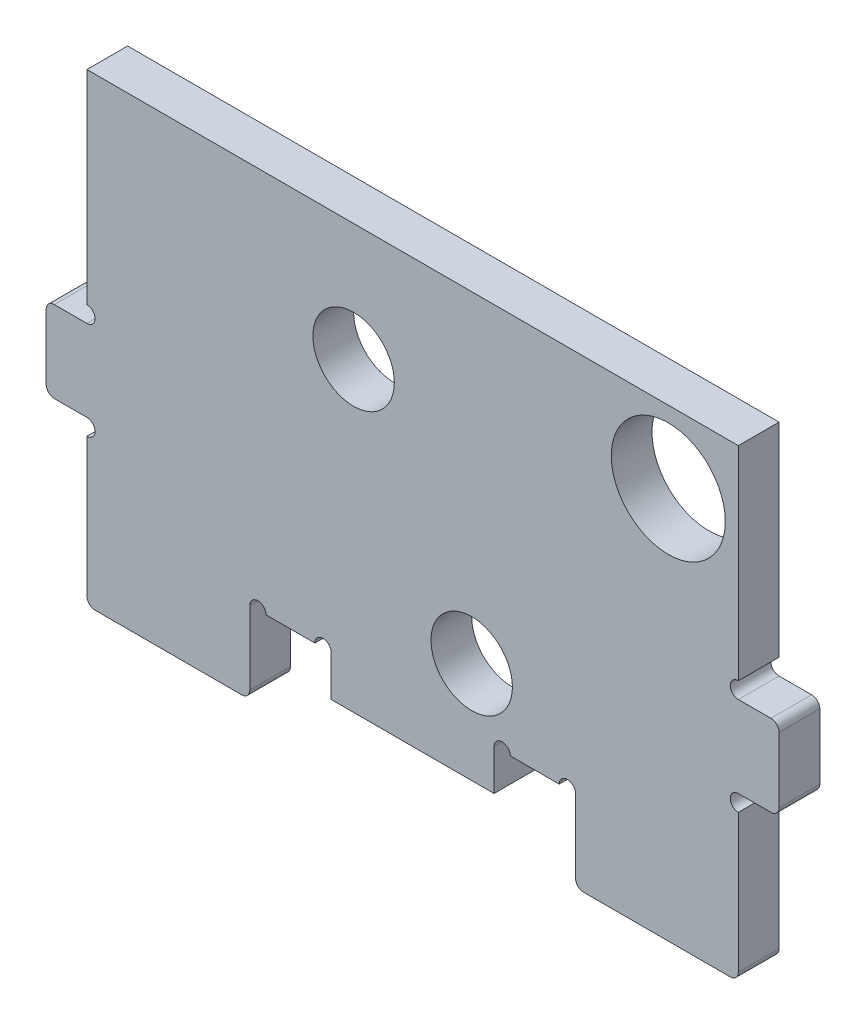
from build123d import *

# Parameters (mm, degrees)
SKETCH_1_W          = 80
SKETCH_1_H          = 52
EXTRUDE_1_DEPTH     = 5
SKETCH_2_R          = 7
CUT_EXTRUDE_1_DEPTH = 5
SKETCH_7_R          = 5
CUT_EXTRUDE_4_DEPTH = 10
SKETCH_10_W         = 10
SKETCH_10_H         = 5
CUT_EXTRUDE_5_DEPTH = 10
SKETCH_14_W         = 20
SKETCH_14_H         = 5
EXTRUDE_4_DEPTH     = 5
SKETCH_15_W         = 5
SKETCH_15_H         = 10
EXTRUDE_5_DEPTH     = 5
SKETCH_11_R         = 1
CUT_EXTRUDE_6_DEPTH = 10
FILLET_2_R          = 1


with BuildPart() as part:
    # 스케치1 → 보스-돌출1 (new body)
    with BuildSketch(Plane.XY):
        with Locations((40, 26)):
            Rectangle(SKETCH_1_W, SKETCH_1_H)
    extrude(amount=EXTRUDE_1_DEPTH)

    # 스케치2 → 컷-돌출1 (cut)
    with BuildSketch(Plane.XY.offset(5)):
        with Locations((71.393420887, 43.125)):
            Circle(SKETCH_2_R)
    extrude(amount=-CUT_EXTRUDE_1_DEPTH, mode=Mode.SUBTRACT)

    # 스케치7 → 컷-돌출4 (cut)
    with BuildSketch(Plane.XY.offset(5)):
        with Locations((32.75, 37.557368355)):
            Circle(SKETCH_7_R)
        with Locations((47.25, 12.442631645)):
            Circle(SKETCH_7_R)
    extrude(amount=-CUT_EXTRUDE_4_DEPTH, mode=Mode.SUBTRACT)

    # 스케치10 → 컷-돌출5 (cut)
    with BuildSketch(Plane(origin=(0, 0, 0), x_dir=(-1, 0, 0), z_dir=(0, 0, -1))):
        with Locations((-25, 2.5)):
            Rectangle(SKETCH_10_W, SKETCH_10_H)
        with Locations((-55, 2.5)):
            Rectangle(SKETCH_10_W, SKETCH_10_H)
    extrude(amount=-CUT_EXTRUDE_5_DEPTH, mode=Mode.SUBTRACT)

    # 스케치14 → 보스-돌출4 (add)
    with BuildSketch(Plane.XY.offset(5)):
        with Locations((70, -2.5)):
            Rectangle(SKETCH_14_W, SKETCH_14_H)
        with Locations((10, -2.5)):
            Rectangle(SKETCH_14_W, SKETCH_14_H)
    extrude(amount=-EXTRUDE_4_DEPTH)

    # 스케치15 → 보스-돌출5 (add)
    with BuildSketch(Plane.XY.offset(5)):
        with Locations((82.5, 20)):
            Rectangle(SKETCH_15_W, SKETCH_15_H)
        with Locations((-2.5, 20)):
            Rectangle(SKETCH_15_W, SKETCH_15_H)
    extrude(amount=-EXTRUDE_5_DEPTH)

    # 스케치11 → 컷-돌출6 (cut)
    with BuildSketch(Plane.XY.offset(5)):
        with Locations((59, 5)):
            Circle(SKETCH_11_R)
        with Locations((51, 5)):
            Circle(SKETCH_11_R)
        with Locations((29, 5)):
            Circle(SKETCH_11_R)
        with Locations((21, 5)):
            Circle(SKETCH_11_R)
        with Locations((80, 14)):
            Circle(SKETCH_11_R)
        with Locations((80, 26)):
            Circle(SKETCH_11_R)
        with Locations((0, 26)):
            Circle(SKETCH_11_R)
        with Locations((0, 14)):
            Circle(SKETCH_11_R)
    extrude(amount=-CUT_EXTRUDE_6_DEPTH, mode=Mode.SUBTRACT)

    # 필렛2
    fillet_2_edges = [part.edges().sort_by_distance(p)[0] for p in [
        (0, -5, 2.5),
        (20, -5, 2.5),
        (60, -5, 2.5),
        (80, -5, 2.5),
        (85, 25, 2.5),
        (85, 15, 2.5),
        (-5, 25, 2.5),
        (-5, 15, 2.5),
    ]]
    fillet(fillet_2_edges, radius=FILLET_2_R)


solid = part.part
